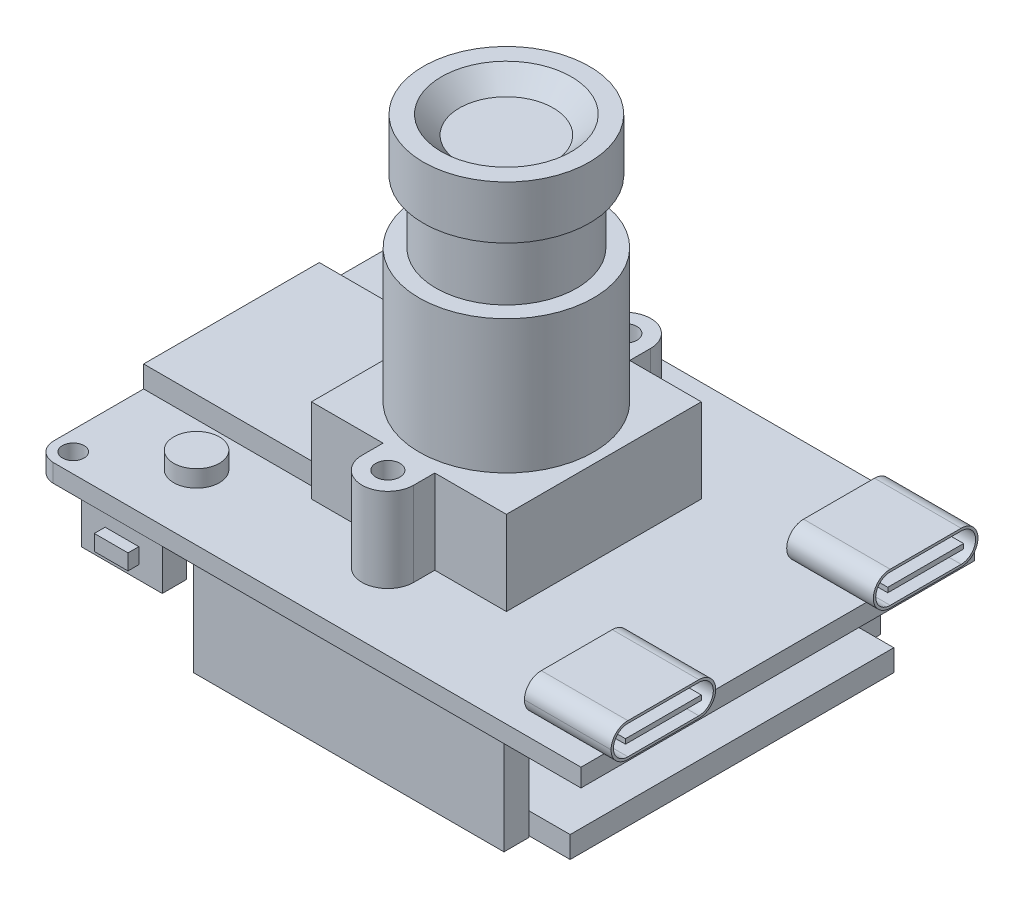
from build123d import *

# Parameters (mm, degrees)
CROQUIS2_W               = 45.4
CROQUIS2_H               = 32.7
SALIENTE_EXTRUIR1_DEPTH  = 1.5
CROQUIS4_R               = 1
SALIENTE_EXTRUIR3_DEPTH  = 7
CROQUIS5_R               = 7.25
SALIENTE_EXTRUIR4_DEPTH  = 11.1
CROQUIS7_R               = 5.85
SALIENTE_EXTRUIR5_DEPTH  = 5.2
CROQUIS13_W              = 7.2
CROQUIS13_H              = 8.7
SALIENTE_EXTRUIR16_DEPTH = 2.8
CORTAR_EXTRUIR2_DEPTH    = 7.2
CROQUIS33_W              = 6.3
CROQUIS33_H              = 0.4
CORTAR_EXTRUIR3_DEPTH    = 7
CROQUIS34_W              = 15.3
CROQUIS34_H              = 14.6
SALIENTE_EXTRUIR17_DEPTH = 1.8
CROQUIS35_W              = 11.2
CROQUIS35_H              = 1.2
CORTAR_EXTRUIR4_DEPTH    = 14
CROQUIS36_R              = 0.9
CORTAR_EXTRUIR5_DEPTH    = 14
CORTAR_EXTRUIR6_DEPTH    = 14
CROQUIS42_R              = 1.9
SALIENTE_EXTRUIR18_DEPTH = 1.4
CROQUIS43_W              = 25.8
CROQUIS43_H              = 2.1
SALIENTE_EXTRUIR19_DEPTH = 8.5
CROQUIS44_W              = 1.1
CROQUIS44_H              = 0.55
CORTAR_EXTRUIR9_DEPTH    = 8.5
CROQUIS45_W              = 6.7
CROQUIS45_H              = 2
SALIENTE_EXTRUIR20_DEPTH = 3.5
CROQUIS49_W              = 2
CROQUIS49_H              = 6.7
SALIENTE_EXTRUIR23_DEPTH = 3.4
CROQUIS50_W              = 2.8
CROQUIS50_H              = 1.3
SALIENTE_EXTRUIR24_DEPTH = 1.1
CROQUIS51_W              = 29.1
CROQUIS51_H              = 26.9
SALIENTE_EXTRUIR26_DEPTH = 1.8
CROQUIS52_W              = 4.2
CROQUIS52_H              = 7.3
SALIENTE_EXTRUIR27_DEPTH = 3.7
CROQUIS54_W              = 1
CROQUIS54_H              = 2.7
CORTAR_EXTRUIR10_DEPTH   = 1
CROQUIS57_W              = 1
CROQUIS57_H              = 1
CORTAR_EXTRUIR11_DEPTH   = 7
CROQUIS58_W              = 5.1
CROQUIS58_H              = 3.5
CORTAR_EXTRUIR12_DEPTH   = 4
CROQUIS60_W              = 0.395951862
CROQUIS60_H              = 0.390527864
CROQUIS60_W_2            = 0.395951861
SALIENTE_EXTRUIR29_DEPTH = 4
CROQUIS63_W              = 2.8
CROQUIS63_H              = 1.3
SALIENTE_EXTRUIR30_DEPTH = 0.9
CROQUIS64_W              = 2.8
CROQUIS64_H              = 1.3
SALIENTE_EXTRUIR31_DEPTH = 0.9
CROQUIS66_R              = 6.9
SALIENTE_EXTRUIR32_DEPTH = 4.4
CROQUIS67_R              = 5.9
CORTAR_EXTRUIR13_DEPTH   = 1.5
CHAFL_N1_SIZE            = 2


with BuildPart() as part:
    # Croquis2 → Saliente-Extruir1 (new body)
    with BuildSketch(Plane(origin=(0, 0, 0), x_dir=(1, 0, 0), z_dir=(0, 1, 0))):
        with Locations((6.06422417, -2.928383998)):
            Rectangle(CROQUIS2_W, CROQUIS2_H)
    extrude(amount=SALIENTE_EXTRUIR1_DEPTH)

    # Croquis4 → Saliente-Extruir3 (add)
    with BuildSketch(Plane(origin=(0, 1.5, 0), x_dir=(1, 0, 0), z_dir=(0, 1, 0))):
        with BuildLine():
            Line((-1.73577583, 5.021616002), (4.213732183, 5.021616002))
            Line((4.213732183, 5.021616002), (4.213732183, 6.771616002))
            ThreePointArc((4.213732183, 6.771616002), (6.363732183, 8.921616002), (8.513732183, 6.771616002))
            Line((8.513732183, 6.771616002), (8.513732183, 5.021616002))
            Line((8.513732183, 5.021616002), (14.46422417, 5.021616002))
            Line((14.46422417, 5.021616002), (14.46422417, -11.178383998))
            Line((14.46422417, -11.178383998), (8.513732183, -11.178383998))
            Line((8.513732183, -11.178383998), (8.513732183, -12.928383998))
            ThreePointArc((8.513732183, -12.928383998), (6.363732183, -15.078383998), (4.213732183, -12.928383998))
            Line((4.213732183, -12.928383998), (4.213732183, -11.178383998))
            Line((4.213732183, -11.178383998), (-1.73577583, -11.178383998))
            Line((-1.73577583, -11.178383998), (-1.73577583, 5.021616002))
        make_face()
        with Locations(Location((6.363732183, 6.771616002, 0), (0, 0, 270))):
            Circle(CROQUIS4_R, mode=Mode.SUBTRACT)
        with Locations(Location((6.363732183, -12.928383998, 0), (0, 0, 270))):
            Circle(CROQUIS4_R, mode=Mode.SUBTRACT)
    extrude(amount=SALIENTE_EXTRUIR3_DEPTH)

    # Croquis5 → Saliente-Extruir4 (add)
    with BuildSketch(Plane(origin=(0, 8.5, 0), x_dir=(1, 0, 0), z_dir=(0, 1, 0))):
        with Locations(Location((6.36422417, -3.078383998, 0), (0, 0, 270))):
            Circle(CROQUIS5_R)
    extrude(amount=SALIENTE_EXTRUIR4_DEPTH)

    # Croquis13 → Saliente-Extruir16 (add)
    with BuildSketch(Plane(origin=(0, 1.5, 0), x_dir=(1, 0, 0), z_dir=(0, 1, 0))):
        with Locations((26.56422417, -13.828383998)):
            Rectangle(CROQUIS13_W, CROQUIS13_H)
    saliente_extruir16 = extrude(amount=SALIENTE_EXTRUIR16_DEPTH)

    # Croquis20 → Cortar-Extruir2 (cut)
    with BuildSketch(Plane(origin=(30.16422417, 0, 0), x_dir=(0, 0, -1), z_dir=(1, 0, 0))):
        with BuildLine():
            ThreePointArc((-18.178383997, 2.899929704), (-17.768358345, 3.88992464), (-16.778383998, 4.3))
            Line((-16.778383998, 4.3), (-18.178383998, 4.3))
            Line((-18.178383998, 4.3), (-18.178383998, 2.899929704))
        make_face()
        with BuildLine():
            ThreePointArc((-16.806302951, 1.5), (-17.778188253, 1.919806354), (-18.178383997, 2.899929704))
            Line((-18.178383998, 2.899929704), (-18.178383998, 1.5))
            Line((-18.178383998, 1.5), (-16.806302951, 1.5))
        make_face()
        with BuildLine():
            Line((-9.478383998, 4.3), (-10.878383998, 4.3))
            ThreePointArc((-10.878383998, 4.3), (-9.888434505, 3.889949494), (-9.478383998, 2.9))
            Line((-9.478383998, 2.9), (-9.478383998, 4.3))
        make_face()
        with BuildLine():
            Line((-9.478383998, 1.5), (-9.478383998, 2.9))
            ThreePointArc((-9.478383998, 2.9), (-9.888434505, 1.910050506), (-10.878383998, 1.5))
            Line((-10.878383998, 1.5), (-9.478383998, 1.5))
        make_face()
    cortar_extruir2 = extrude(amount=-CORTAR_EXTRUIR2_DEPTH, mode=Mode.SUBTRACT)

    # Croquis33 → Cortar-Extruir3 (cut)
    with BuildSketch(Plane(origin=(30.16422417, 0, 0), x_dir=(0, 0, -1), z_dir=(1, 0, 0))):
        with BuildLine():
            Line((-16.778383998, 4.1), (-10.878383998, 4.1))
            ThreePointArc((-10.878383998, 4.1), (-9.678383998, 2.9), (-10.878383998, 1.7))
            Line((-10.878383998, 1.7), (-16.778383998, 1.7))
            ThreePointArc((-16.778383998, 1.7), (-17.978383998, 2.9), (-16.778383998, 4.1))
        make_face()
        with Locations((-13.828383998, 2.9)):
            Rectangle(CROQUIS33_W, CROQUIS33_H, mode=Mode.SUBTRACT)
    cortar_extruir3 = extrude(amount=-CORTAR_EXTRUIR3_DEPTH, mode=Mode.SUBTRACT)

    # Croquis34 → Saliente-Extruir17 (add)
    with BuildSketch(Plane(origin=(0, 1.5, 0), x_dir=(1, 0, 0), z_dir=(0, 1, 0))):
        with Locations((-8.98577583, -2.928383998)):
            Rectangle(CROQUIS34_W, CROQUIS34_H)
    extrude(amount=SALIENTE_EXTRUIR17_DEPTH)

    # Croquis35 → Cortar-Extruir4 (cut)
    with BuildSketch(Plane.ZY.offset(16.63577583)):
        with Locations((2.228383998, 2.1)):
            Rectangle(CROQUIS35_W, CROQUIS35_H)
    extrude(amount=-CORTAR_EXTRUIR4_DEPTH, mode=Mode.SUBTRACT)

    # Croquis36 → Cortar-Extruir5 (cut)
    with BuildSketch(Plane(origin=(0, 1.5, 0), x_dir=(1, 0, 0), z_dir=(0, 1, 0))):
        with Locations(Location((-15.03577583, 11.821616002, 0), (0, 0, 270))):
            Circle(CROQUIS36_R)
        with Locations(Location((-15.03577583, -17.678383998, 0), (0, 0, 270))):
            Circle(CROQUIS36_R)
    extrude(amount=-CORTAR_EXTRUIR5_DEPTH, mode=Mode.SUBTRACT)

    # Croquis41 → Cortar-Extruir6 (cut)
    with BuildSketch(Plane(origin=(0, 1.5, 0), x_dir=(1, 0, 0), z_dir=(0, 1, 0))):
        with BuildLine():
            Line((-16.63577583, 13.421616002), (-16.63577583, 11.8844475))
            ThreePointArc((-16.63577583, 11.8844475), (-16.168018692, 12.953858864), (-15.098607328, 13.421616002))
            Line((-15.098607328, 13.421616002), (-16.63577583, 13.421616002))
        make_face()
        with BuildLine():
            Line((-16.63577583, -17.741215497), (-16.63577583, -19.278383998))
            Line((-16.63577583, -19.278383998), (-15.098607328, -19.278383998))
            ThreePointArc((-15.098607328, -19.278383998), (-16.168018692, -18.81062686), (-16.63577583, -17.741215497))
        make_face()
    extrude(amount=-CORTAR_EXTRUIR6_DEPTH, mode=Mode.SUBTRACT)

    # Croquis42 → Saliente-Extruir18 (add)
    with BuildSketch(Plane(origin=(0, 1.5, 0), x_dir=(1, 0, 0), z_dir=(0, 1, 0))):
        with Locations(Location((-8.63577583, -13.828383998, 0), (0, 0, 270))):
            Circle(CROQUIS42_R)
    extrude(amount=SALIENTE_EXTRUIR18_DEPTH)

    # Croquis43 → Saliente-Extruir19 (add)
    with BuildSketch(Plane.XZ):
        with Locations((8.76422417, 17.528383998)):
            Rectangle(CROQUIS43_W, CROQUIS43_H)
        with Locations((8.76422417, -11.671616002)):
            Rectangle(CROQUIS43_W, CROQUIS43_H)
    extrude(amount=SALIENTE_EXTRUIR19_DEPTH)

    # Croquis44 → Cortar-Extruir9 (cut)
    with BuildSketch(Plane.XZ.offset(8.5)):
        with Locations((-2.68577583, 17.803383998)):
            Rectangle(CROQUIS44_W, CROQUIS44_H)
        with Locations((-2.68577583, 17.253383998)):
            Rectangle(CROQUIS44_W, CROQUIS44_H)
        with Locations((-0.134936, 17.803383998)):
            Rectangle(CROQUIS44_W, CROQUIS44_H)
        with Locations((-0.134936, 17.253383998)):
            Rectangle(CROQUIS44_W, CROQUIS44_H)
        with Locations((2.415903829, 17.253383998)):
            Rectangle(CROQUIS44_W, CROQUIS44_H)
        with Locations((2.415903829, 17.803383998)):
            Rectangle(CROQUIS44_W, CROQUIS44_H)
        with Locations((4.966743658, 17.253383998)):
            Rectangle(CROQUIS44_W, CROQUIS44_H)
        with Locations((4.966743658, 17.803383998)):
            Rectangle(CROQUIS44_W, CROQUIS44_H)
        with Locations((7.517583488, 17.253383998)):
            Rectangle(CROQUIS44_W, CROQUIS44_H)
        with Locations((7.517583488, 17.803383998)):
            Rectangle(CROQUIS44_W, CROQUIS44_H)
        with Locations((10.068423317, 17.803383998)):
            Rectangle(CROQUIS44_W, CROQUIS44_H)
        with Locations((10.068423317, 17.253383998)):
            Rectangle(CROQUIS44_W, CROQUIS44_H)
        with Locations((12.619263147, 17.803383998)):
            Rectangle(CROQUIS44_W, CROQUIS44_H)
        with Locations((12.619263147, 17.253383998)):
            Rectangle(CROQUIS44_W, CROQUIS44_H)
        with Locations((15.170102976, 17.803383998)):
            Rectangle(CROQUIS44_W, CROQUIS44_H)
        with Locations((15.170102976, 17.253383998)):
            Rectangle(CROQUIS44_W, CROQUIS44_H)
        with Locations((17.720942805, 17.803383998)):
            Rectangle(CROQUIS44_W, CROQUIS44_H)
        with Locations((17.720942805, 17.253383998)):
            Rectangle(CROQUIS44_W, CROQUIS44_H)
        with Locations((20.271782635, 17.803383998)):
            Rectangle(CROQUIS44_W, CROQUIS44_H)
        with Locations((20.271782635, 17.253383998)):
            Rectangle(CROQUIS44_W, CROQUIS44_H)
    cortar_extruir9 = extrude(amount=-CORTAR_EXTRUIR9_DEPTH, mode=Mode.SUBTRACT)

    # Croquis45 → Saliente-Extruir20 (add)
    with BuildSketch(Plane.XZ):
        with Locations((-9.48577583, 18.178383998)):
            Rectangle(CROQUIS45_W, CROQUIS45_H)
        with Locations((-9.48577583, -12.321616002)):
            Rectangle(CROQUIS45_W, CROQUIS45_H)
    extrude(amount=SALIENTE_EXTRUIR20_DEPTH)

    # Croquis49 → Saliente-Extruir23 (add)
    with BuildSketch(Plane.XZ):
        with Locations((-15.53577583, -5.571616002)):
            Rectangle(CROQUIS49_W, CROQUIS49_H)
    extrude(amount=SALIENTE_EXTRUIR23_DEPTH)

    # Croquis50 → Saliente-Extruir24 (add)
    with BuildSketch(Plane.ZY.offset(16.53577583)):
        with Locations((-5.571616002, -1.75)):
            Rectangle(CROQUIS50_W, CROQUIS50_H)
    extrude(amount=SALIENTE_EXTRUIR24_DEPTH)

    # Croquis52 → Saliente-Extruir27 (add)
    with BuildSketch(Plane.XZ):
        with Locations((-14.43577583, 10.128383998)):
            Rectangle(CROQUIS52_W, CROQUIS52_H)
    extrude(amount=SALIENTE_EXTRUIR27_DEPTH)

    # Croquis54 → Cortar-Extruir10 (cut)
    with BuildSketch(Plane.ZY.offset(16.53577583)):
        with Locations((13.278383998, -1.35)):
            Rectangle(CROQUIS54_W, CROQUIS54_H)
        with Locations((6.978383998, -1.35)):
            Rectangle(CROQUIS54_W, CROQUIS54_H)
    extrude(amount=-CORTAR_EXTRUIR10_DEPTH, mode=Mode.SUBTRACT)

    # Croquis57 → Cortar-Extruir11 (cut)
    with BuildSketch(Plane.ZY.offset(16.53577583)):
        with Locations((6.978383998, -3.2)):
            Rectangle(CROQUIS57_W, CROQUIS57_H)
        with Locations((13.278383998, -3.2)):
            Rectangle(CROQUIS57_W, CROQUIS57_H)
    extrude(amount=-CORTAR_EXTRUIR11_DEPTH, mode=Mode.SUBTRACT)

    # Croquis58 → Cortar-Extruir12 (cut)
    with BuildSketch(Plane.ZY.offset(16.53577583)):
        with Locations((10.128383998, -1.85)):
            Rectangle(CROQUIS58_W, CROQUIS58_H)
    extrude(amount=-CORTAR_EXTRUIR12_DEPTH, mode=Mode.SUBTRACT)

    # Croquis60 → Saliente-Extruir29 (add)
    with BuildSketch(Plane.ZY.offset(12.53577583)):
        with Locations((10.832209252, -1.768105074)):
            Rectangle(CROQUIS60_W, CROQUIS60_H)
        with Locations((9.424558745, -1.768105074)):
            Rectangle(CROQUIS60_W_2, CROQUIS60_H)
    extrude(amount=SALIENTE_EXTRUIR29_DEPTH)

    # Simetría1: Saliente-Extruir16, Cortar-Extruir2, Cortar-Extruir3 across plane
    add(saliente_extruir16.mirror(Plane.XY.offset(2.928383998)))
    add(cortar_extruir2.mirror(Plane.XY.offset(2.928383998)), mode=Mode.SUBTRACT)
    add(cortar_extruir3.mirror(Plane.XY.offset(2.928383998)), mode=Mode.SUBTRACT)

    # Simetría13: Cortar-Extruir9 across plane
    add(cortar_extruir9.mirror(Plane.XY.offset(2.928383998)), mode=Mode.SUBTRACT)

    # Croquis63 → Saliente-Extruir30 (add)
    with BuildSketch(Plane.XY.offset(19.178383998)):
        with Locations((-9.48577583, -1.75)):
            Rectangle(CROQUIS63_W, CROQUIS63_H)
    extrude(amount=SALIENTE_EXTRUIR30_DEPTH)

    # Croquis64 → Saliente-Extruir31 (add)
    with BuildSketch(Plane(origin=(0, 0, -13.321616002), x_dir=(-1, 0, 0), z_dir=(0, 0, -1))):
        with Locations((9.48577583, -1.75)):
            Rectangle(CROQUIS64_W, CROQUIS64_H)
    extrude(amount=SALIENTE_EXTRUIR31_DEPTH)


with BuildPart() as body_2:
    # Croquis7 → Saliente-Extruir5 (new body)
    with BuildSketch(Plane(origin=(0, 19.6, 0), x_dir=(1, 0, 0), z_dir=(0, 1, 0))):
        with Locations(Location((6.36422417, -3.078383998, 0), (0, 0, 270))):
            Circle(CROQUIS7_R)
    extrude(amount=SALIENTE_EXTRUIR5_DEPTH)

    # Croquis66 → Saliente-Extruir32 (add)
    with BuildSketch(Plane(origin=(0, 24.8, 0), x_dir=(1, 0, 0), z_dir=(0, 1, 0))):
        with Locations(Location((6.36422417, -3.078383998, 0), (0, 0, 270))):
            Circle(CROQUIS66_R)
    extrude(amount=SALIENTE_EXTRUIR32_DEPTH)

    # Croquis67 → Cortar-Extruir13 (cut)
    with BuildSketch(Plane(origin=(0, 29.2, 0), x_dir=(1, 0, 0), z_dir=(0, 1, 0))):
        with Locations(Location((6.36422417, -3.078383998, 0), (0, 0, 270))):
            Circle(CROQUIS67_R)
    extrude(amount=-CORTAR_EXTRUIR13_DEPTH, mode=Mode.SUBTRACT)

    # Chaflán1
    # the kernel refuses this chamfer: 2 mm, written as the material it adds along each edge
    with BuildSketch(Plane(origin=(6.36422417, 27.7, 3.078383998), x_dir=(0, 0, 1), z_dir=(-1, 0, 0))) as chafl_n1_piece_1_section:
        Polygon((5.9, CHAFL_N1_SIZE), (5.9 - CHAFL_N1_SIZE, 0), (5.9, 0), align=None)
    chafl_n1_piece_1 = revolve(axis=Axis((6.36422417, 27.7, 3.078383998), (0, 1, 0)), mode=Mode.PRIVATE)
    chafl_n1_piece_1 = split(chafl_n1_piece_1, bisect_by=Plane(origin=(6.36422417, 29.2, -1.571970761), z_dir=(0, -1, 0)), keep=Keep.TOP, mode=Mode.PRIVATE)
    add(chafl_n1_piece_1)


with BuildPart() as body_3:
    # Croquis51 → Saliente-Extruir26 (new body)
    with BuildSketch(Plane.XZ.offset(8.5)):
        with Locations((10.41422417, 2.928383998)):
            Rectangle(CROQUIS51_W, CROQUIS51_H)
    extrude(amount=-SALIENTE_EXTRUIR26_DEPTH)


solid = Compound([part.part, body_2.part, body_3.part])
